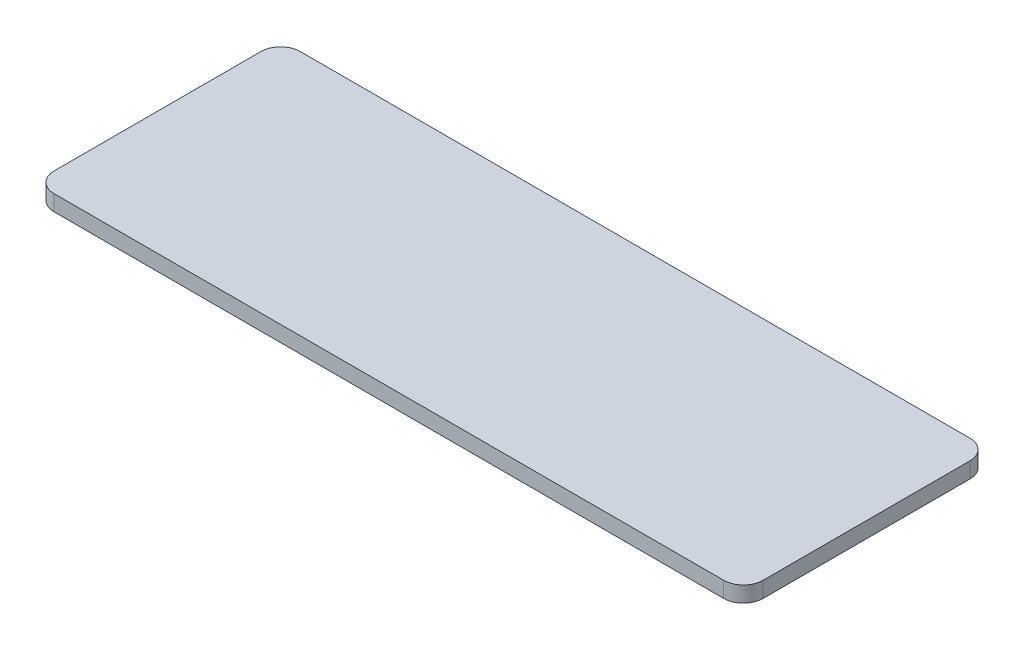
from build123d import *

# Parameters (mm, degrees)
SKETCH1_W           = 72
SKETCH1_H           = 25
BOSS_EXTRUDE1_DEPTH = 1.6
FILLET1_R           = 2


with BuildPart() as part:
    # Sketch1 → Boss-Extrude1 (new body)
    with BuildSketch(Plane(origin=(0, 0, 0), x_dir=(1, 0, 0), z_dir=(0, 1, 0))):
        with Locations((36, 12.5)):
            Rectangle(SKETCH1_W, SKETCH1_H)
    extrude(amount=BOSS_EXTRUDE1_DEPTH)

    # Fillet1
    fillet1_edges = [part.edges().sort_by_distance(p)[0] for p in [
        (0, 0.8, 0),
        (0, 0.8, -25),
        (72, 0.8, -25),
        (72, 0.8, 0),
    ]]
    fillet(fillet1_edges, radius=FILLET1_R)


solid = part.part
